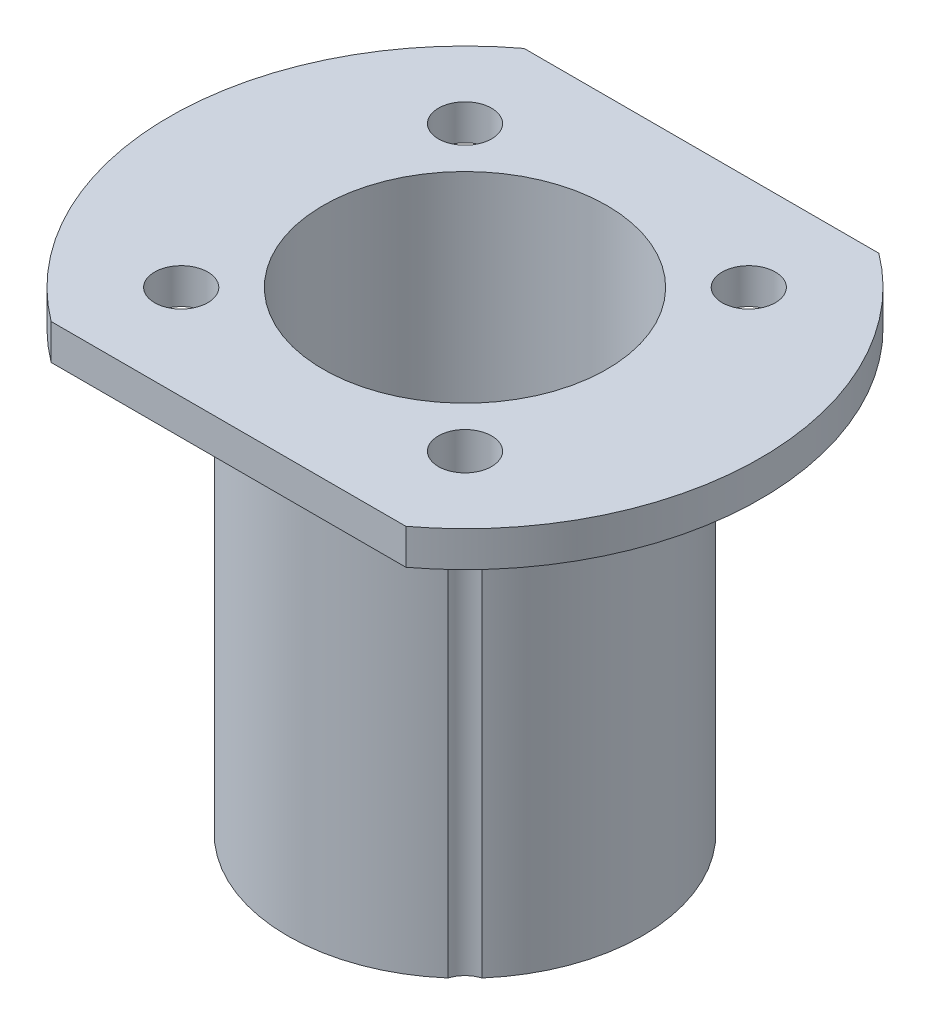
from build123d import *

# Parameters (mm, degrees)
CUT_EXTRUDE3_START   = 37
CUT_EXTRUDE3_DEPTH   = 3
M4_CLEARANCE_HOLE1_D = 4.5


# Read off the part's stored shape, not the designer's step: Cut-Extrude3
with BuildPart() as part:
    # Sketch1 → Revolve1 (revolve)
    with BuildSketch(Plane.XY, mode=Mode.PRIVATE) as revolve1_sk:
        Polygon((12, 40), (12, 0), (15, 0), (15, 37), (25, 37), (25, 40), align=None)
    revolve(revolve1_sk.sketch.rotate(Axis((0, 0, 0), (0, 1, 0)), 90), axis=Axis((0, 0, 0), (0, 1, 0)))

    # Cut-Extrude3 outline → Cut-Extrude3 (cut)
    with BuildSketch(Plane(origin=(0, 0, 0), x_dir=(1, 0, 0), z_dir=(0, 1, 0)).offset(CUT_EXTRUDE3_START)):
        with BuildLine():
            Line((15, -20), (-15, -20))
            ThreePointArc((-15, -20), (0, -25), (15, -20))
        make_face()
        with BuildLine():
            ThreePointArc((15, 20), (0, 25), (-15, 20))
            Line((-15, 20), (15, 20))
        make_face()
    extrude(amount=CUT_EXTRUDE3_DEPTH, mode=Mode.SUBTRACT)

    # M4 Clearance Hole1 (through all)
    with Locations(Plane(origin=(0, 40, 0), x_dir=(1, 0, 0), z_dir=(0, 1, 0))):
        with Locations((-12, 12), (12, 12), (12, -12), (-12, -12), (0, 0)):
            Hole(M4_CLEARANCE_HOLE1_D / 2)


solid = part.part
